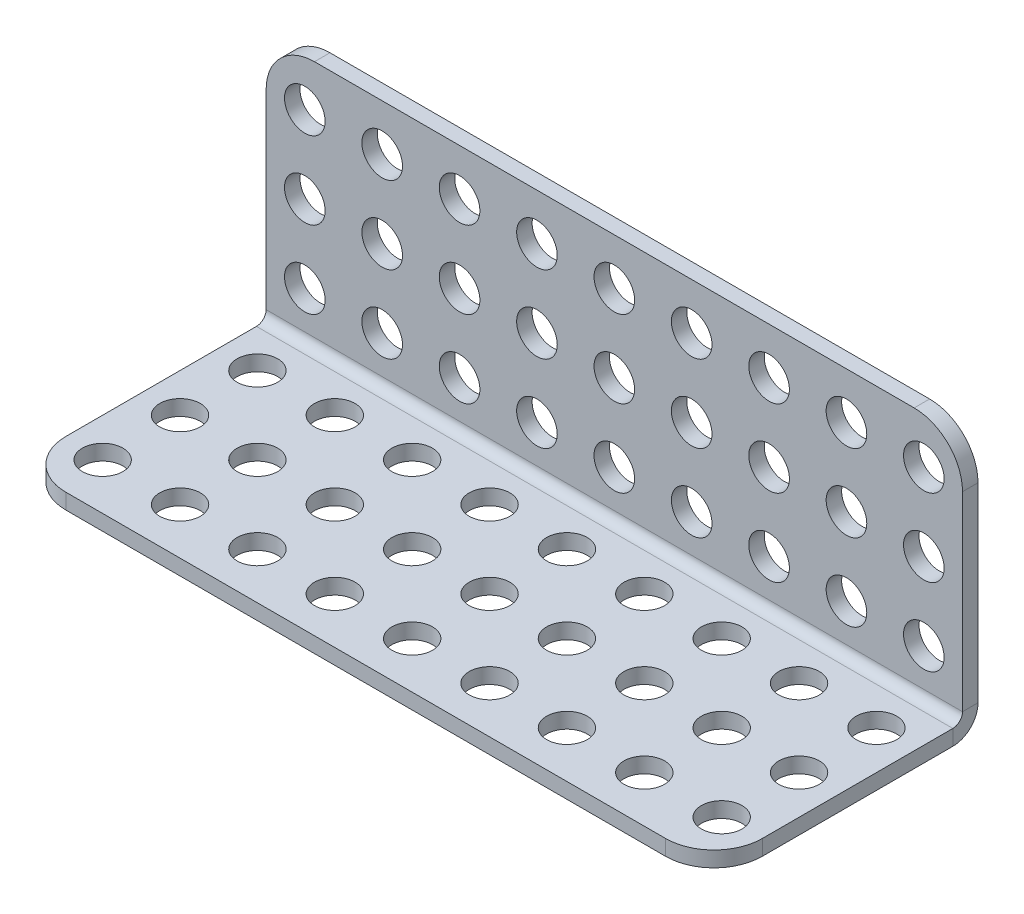
from build123d import *

# Parameters (mm, degrees)
BASE_FLANGE1_DEPTH         = 72
FILLET1_R                  = 5
SKETCH6_R                  = 2.1
CUT_EXTRUDE1_DEPTH         = 82.177459926
SKETCH7_R                  = 2.1
CUT_EXTRUDE2_DEPTH         = 82.177459926
LPATTERN2_COUNT            = 3
LPATTERN2_PITCH            = 8
LPATTERN3_COUNT            = 3
LPATTERN3_PITCH            = 8
LPATTERN1_COUNT            = 9
LPATTERN1_PITCH            = 8
LPATTERN1_COPY_1_SKETCH_R  = 2.1
LPATTERN1_COPY_1_DEPTH     = 82.177459926
LPATTERN1_COPY_2_SKETCH_R  = 2.1
LPATTERN1_COPY_2_DEPTH     = 82.177459926
LPATTERN1_COPY_3_SKETCH_R  = 2.1
LPATTERN1_COPY_3_DEPTH     = 82.177459926
LPATTERN1_COPY_4_SKETCH_R  = 2.1
LPATTERN1_COPY_4_DEPTH     = 82.177459926
LPATTERN1_COPY_5_SKETCH_R  = 2.1
LPATTERN1_COPY_5_DEPTH     = 82.177459926
LPATTERN1_COPY_6_SKETCH_R  = 2.1
LPATTERN1_COPY_6_DEPTH     = 82.177459926
LPATTERN1_COPY_7_SKETCH_R  = 2.1
LPATTERN1_COPY_7_DEPTH     = 82.177459926
LPATTERN1_COPY_8_SKETCH_R  = 2.1
LPATTERN1_COPY_8_DEPTH     = 82.177459926
LPATTERN1_COPY_9_SKETCH_R  = 2.1
LPATTERN1_COPY_9_DEPTH     = 82.177459926
LPATTERN1_COPY_10_SKETCH_R = 2.1
LPATTERN1_COPY_10_DEPTH    = 82.177459926
LPATTERN1_COPY_11_SKETCH_R = 2.1
LPATTERN1_COPY_11_DEPTH    = 82.177459926
LPATTERN1_COPY_12_SKETCH_R = 2.1
LPATTERN1_COPY_12_DEPTH    = 82.177459926
LPATTERN1_COPY_13_SKETCH_R = 2.1
LPATTERN1_COPY_13_DEPTH    = 82.177459926
LPATTERN1_COPY_14_SKETCH_R = 2.1
LPATTERN1_COPY_14_DEPTH    = 82.177459926
LPATTERN1_COPY_15_SKETCH_R = 2.1
LPATTERN1_COPY_15_DEPTH    = 82.177459926
LPATTERN1_COPY_16_SKETCH_R = 2.1
LPATTERN1_COPY_16_DEPTH    = 82.177459926
LPATTERN1_COPY_17_SKETCH_R = 2.1
LPATTERN1_COPY_17_DEPTH    = 82.177459926
LPATTERN1_COPY_18_SKETCH_R = 2.1
LPATTERN1_COPY_18_DEPTH    = 82.177459926
LPATTERN1_COPY_19_SKETCH_R = 2.1
LPATTERN1_COPY_19_DEPTH    = 82.177459926
LPATTERN1_COPY_20_SKETCH_R = 2.1
LPATTERN1_COPY_20_DEPTH    = 82.177459926
LPATTERN1_COPY_21_SKETCH_R = 2.1
LPATTERN1_COPY_21_DEPTH    = 82.177459926
LPATTERN1_COPY_22_SKETCH_R = 2.1
LPATTERN1_COPY_22_DEPTH    = 82.177459926
LPATTERN1_COPY_23_SKETCH_R = 2.1
LPATTERN1_COPY_23_DEPTH    = 82.177459926
LPATTERN1_COPY_24_SKETCH_R = 2.1
LPATTERN1_COPY_24_DEPTH    = 82.177459926
LPATTERN1_COPY_25_SKETCH_R = 2.1
LPATTERN1_COPY_25_DEPTH    = 82.177459926
LPATTERN1_COPY_26_SKETCH_R = 2.1
LPATTERN1_COPY_26_DEPTH    = 82.177459926
LPATTERN1_COPY_27_SKETCH_R = 2.1
LPATTERN1_COPY_27_DEPTH    = 82.177459926
LPATTERN1_COPY_28_SKETCH_R = 2.1
LPATTERN1_COPY_28_DEPTH    = 82.177459926
LPATTERN1_COPY_29_SKETCH_R = 2.1
LPATTERN1_COPY_29_DEPTH    = 82.177459926
LPATTERN1_COPY_30_SKETCH_R = 2.1
LPATTERN1_COPY_30_DEPTH    = 82.177459926
LPATTERN1_COPY_31_SKETCH_R = 2.1
LPATTERN1_COPY_31_DEPTH    = 82.177459926
LPATTERN1_COPY_32_SKETCH_R = 2.1
LPATTERN1_COPY_32_DEPTH    = 82.177459926


# Sheet-metal steps are written as plain solids
with BuildPart() as part:
    # Sketch1 → Base-Flange1 (new body)
    with BuildSketch(Plane(origin=(0, 0, 0), x_dir=(0, 0, -1), z_dir=(1, 0, 0))):
        with BuildLine():
            Line((0, 27.3), (0, 2.6))
            ThreePointArc((0, 2.6), (-0.761522369, 0.761522369), (-2.6, 0))
            Line((-2.6, 0), (-27.3, 0))
            Line((-27.3, 0), (-27.3, 1.6))
            Line((-27.3, 1.6), (-2.6, 1.6))
            ThreePointArc((-2.6, 1.6), (-1.892893219, 1.892893219), (-1.6, 2.6))
            Line((-1.6, 2.6), (-1.6, 27.3))
            Line((-1.6, 27.3), (0, 27.3))
        make_face()
    extrude(amount=BASE_FLANGE1_DEPTH)

    # Fillet1
    fillet1_edges = [part.edges().sort_by_distance(p)[0] for p in [
        (72, 27.3, 0.8),
        (72, 0.8, 27.3),
        (0, 27.3, 0.8),
        (0, 0.8, 27.3),
    ]]
    fillet(fillet1_edges, radius=FILLET1_R)

    # Sketch6 → Cut-Extrude1 (cut, through all)
    with BuildSketch(Plane.XY.offset(1.6)):
        with Locations((4, 6.5)):
            Circle(SKETCH6_R)
    cut_extrude1 = extrude(amount=-CUT_EXTRUDE1_DEPTH, mode=Mode.SUBTRACT)

    # Sketch7 → Cut-Extrude2 (cut, through all)
    with BuildSketch(Plane(origin=(0, 1.6, 0), x_dir=(1, 0, 0), z_dir=(0, 1, 0))):
        with Locations(Location((4, -6.5, 0), (0, 0, 270))):
            Circle(SKETCH7_R)
    cut_extrude2 = extrude(amount=-CUT_EXTRUDE2_DEPTH, mode=Mode.SUBTRACT)

    # LPattern2: Cut-Extrude1 ×3
    with Locations(*[(0, i * LPATTERN2_PITCH, 0) for i in range(1, LPATTERN2_COUNT)]):
        add(cut_extrude1, mode=Mode.SUBTRACT)

    # LPattern3: Cut-Extrude2 ×3
    with Locations(*[(0, 0, i * LPATTERN3_PITCH) for i in range(1, LPATTERN3_COUNT)]):
        add(cut_extrude2, mode=Mode.SUBTRACT)

    # LPattern1: Cut-Extrude1, Cut-Extrude2 ×9
    with Locations(*[(i * LPATTERN1_PITCH, 0, 0) for i in range(1, LPATTERN1_COUNT)]):
        add(cut_extrude1, mode=Mode.SUBTRACT)
        add(cut_extrude2, mode=Mode.SUBTRACT)

    # LPattern1 copy 1 sketch → LPattern1 copy 1 (cut, through all)
    with BuildSketch(Plane(origin=(8, 8, 1.6), x_dir=(1, 0, 0), z_dir=(0, 0, 1))):
        with Locations((4, 6.5)):
            Circle(LPATTERN1_COPY_1_SKETCH_R)
    extrude(amount=-LPATTERN1_COPY_1_DEPTH, mode=Mode.SUBTRACT)

    # LPattern1 copy 2 sketch → LPattern1 copy 2 (cut, through all)
    with BuildSketch(Plane(origin=(16, 8, 1.6), x_dir=(1, 0, 0), z_dir=(0, 0, 1))):
        with Locations((4, 6.5)):
            Circle(LPATTERN1_COPY_2_SKETCH_R)
    extrude(amount=-LPATTERN1_COPY_2_DEPTH, mode=Mode.SUBTRACT)

    # LPattern1 copy 3 sketch → LPattern1 copy 3 (cut, through all)
    with BuildSketch(Plane(origin=(24, 8, 1.6), x_dir=(1, 0, 0), z_dir=(0, 0, 1))):
        with Locations((4, 6.5)):
            Circle(LPATTERN1_COPY_3_SKETCH_R)
    extrude(amount=-LPATTERN1_COPY_3_DEPTH, mode=Mode.SUBTRACT)

    # LPattern1 copy 4 sketch → LPattern1 copy 4 (cut, through all)
    with BuildSketch(Plane(origin=(32, 8, 1.6), x_dir=(1, 0, 0), z_dir=(0, 0, 1))):
        with Locations((4, 6.5)):
            Circle(LPATTERN1_COPY_4_SKETCH_R)
    extrude(amount=-LPATTERN1_COPY_4_DEPTH, mode=Mode.SUBTRACT)

    # LPattern1 copy 5 sketch → LPattern1 copy 5 (cut, through all)
    with BuildSketch(Plane(origin=(40, 8, 1.6), x_dir=(1, 0, 0), z_dir=(0, 0, 1))):
        with Locations((4, 6.5)):
            Circle(LPATTERN1_COPY_5_SKETCH_R)
    extrude(amount=-LPATTERN1_COPY_5_DEPTH, mode=Mode.SUBTRACT)

    # LPattern1 copy 6 sketch → LPattern1 copy 6 (cut, through all)
    with BuildSketch(Plane(origin=(48, 8, 1.6), x_dir=(1, 0, 0), z_dir=(0, 0, 1))):
        with Locations((4, 6.5)):
            Circle(LPATTERN1_COPY_6_SKETCH_R)
    extrude(amount=-LPATTERN1_COPY_6_DEPTH, mode=Mode.SUBTRACT)

    # LPattern1 copy 7 sketch → LPattern1 copy 7 (cut, through all)
    with BuildSketch(Plane(origin=(56, 8, 1.6), x_dir=(1, 0, 0), z_dir=(0, 0, 1))):
        with Locations((4, 6.5)):
            Circle(LPATTERN1_COPY_7_SKETCH_R)
    extrude(amount=-LPATTERN1_COPY_7_DEPTH, mode=Mode.SUBTRACT)

    # LPattern1 copy 8 sketch → LPattern1 copy 8 (cut, through all)
    with BuildSketch(Plane(origin=(64, 8, 1.6), x_dir=(1, 0, 0), z_dir=(0, 0, 1))):
        with Locations((4, 6.5)):
            Circle(LPATTERN1_COPY_8_SKETCH_R)
    extrude(amount=-LPATTERN1_COPY_8_DEPTH, mode=Mode.SUBTRACT)

    # LPattern1 copy 9 sketch → LPattern1 copy 9 (cut, through all)
    with BuildSketch(Plane(origin=(8, 16, 1.6), x_dir=(1, 0, 0), z_dir=(0, 0, 1))):
        with Locations((4, 6.5)):
            Circle(LPATTERN1_COPY_9_SKETCH_R)
    extrude(amount=-LPATTERN1_COPY_9_DEPTH, mode=Mode.SUBTRACT)

    # LPattern1 copy 10 sketch → LPattern1 copy 10 (cut, through all)
    with BuildSketch(Plane(origin=(16, 16, 1.6), x_dir=(1, 0, 0), z_dir=(0, 0, 1))):
        with Locations((4, 6.5)):
            Circle(LPATTERN1_COPY_10_SKETCH_R)
    extrude(amount=-LPATTERN1_COPY_10_DEPTH, mode=Mode.SUBTRACT)

    # LPattern1 copy 11 sketch → LPattern1 copy 11 (cut, through all)
    with BuildSketch(Plane(origin=(24, 16, 1.6), x_dir=(1, 0, 0), z_dir=(0, 0, 1))):
        with Locations((4, 6.5)):
            Circle(LPATTERN1_COPY_11_SKETCH_R)
    extrude(amount=-LPATTERN1_COPY_11_DEPTH, mode=Mode.SUBTRACT)

    # LPattern1 copy 12 sketch → LPattern1 copy 12 (cut, through all)
    with BuildSketch(Plane(origin=(32, 16, 1.6), x_dir=(1, 0, 0), z_dir=(0, 0, 1))):
        with Locations((4, 6.5)):
            Circle(LPATTERN1_COPY_12_SKETCH_R)
    extrude(amount=-LPATTERN1_COPY_12_DEPTH, mode=Mode.SUBTRACT)

    # LPattern1 copy 13 sketch → LPattern1 copy 13 (cut, through all)
    with BuildSketch(Plane(origin=(40, 16, 1.6), x_dir=(1, 0, 0), z_dir=(0, 0, 1))):
        with Locations((4, 6.5)):
            Circle(LPATTERN1_COPY_13_SKETCH_R)
    extrude(amount=-LPATTERN1_COPY_13_DEPTH, mode=Mode.SUBTRACT)

    # LPattern1 copy 14 sketch → LPattern1 copy 14 (cut, through all)
    with BuildSketch(Plane(origin=(48, 16, 1.6), x_dir=(1, 0, 0), z_dir=(0, 0, 1))):
        with Locations((4, 6.5)):
            Circle(LPATTERN1_COPY_14_SKETCH_R)
    extrude(amount=-LPATTERN1_COPY_14_DEPTH, mode=Mode.SUBTRACT)

    # LPattern1 copy 15 sketch → LPattern1 copy 15 (cut, through all)
    with BuildSketch(Plane(origin=(56, 16, 1.6), x_dir=(1, 0, 0), z_dir=(0, 0, 1))):
        with Locations((4, 6.5)):
            Circle(LPATTERN1_COPY_15_SKETCH_R)
    extrude(amount=-LPATTERN1_COPY_15_DEPTH, mode=Mode.SUBTRACT)

    # LPattern1 copy 16 sketch → LPattern1 copy 16 (cut, through all)
    with BuildSketch(Plane(origin=(64, 16, 1.6), x_dir=(1, 0, 0), z_dir=(0, 0, 1))):
        with Locations((4, 6.5)):
            Circle(LPATTERN1_COPY_16_SKETCH_R)
    extrude(amount=-LPATTERN1_COPY_16_DEPTH, mode=Mode.SUBTRACT)

    # LPattern1 copy 17 sketch → LPattern1 copy 17 (cut, through all)
    with BuildSketch(Plane(origin=(8, 1.6, 8), x_dir=(1, 0, 0), z_dir=(0, 1, 0))):
        with Locations(Location((4, -6.5, 0), (0, 0, 270))):
            Circle(LPATTERN1_COPY_17_SKETCH_R)
    extrude(amount=-LPATTERN1_COPY_17_DEPTH, mode=Mode.SUBTRACT)

    # LPattern1 copy 18 sketch → LPattern1 copy 18 (cut, through all)
    with BuildSketch(Plane(origin=(16, 1.6, 8), x_dir=(1, 0, 0), z_dir=(0, 1, 0))):
        with Locations(Location((4, -6.5, 0), (0, 0, 270))):
            Circle(LPATTERN1_COPY_18_SKETCH_R)
    extrude(amount=-LPATTERN1_COPY_18_DEPTH, mode=Mode.SUBTRACT)

    # LPattern1 copy 19 sketch → LPattern1 copy 19 (cut, through all)
    with BuildSketch(Plane(origin=(24, 1.6, 8), x_dir=(1, 0, 0), z_dir=(0, 1, 0))):
        with Locations(Location((4, -6.5, 0), (0, 0, 270))):
            Circle(LPATTERN1_COPY_19_SKETCH_R)
    extrude(amount=-LPATTERN1_COPY_19_DEPTH, mode=Mode.SUBTRACT)

    # LPattern1 copy 20 sketch → LPattern1 copy 20 (cut, through all)
    with BuildSketch(Plane(origin=(32, 1.6, 8), x_dir=(1, 0, 0), z_dir=(0, 1, 0))):
        with Locations(Location((4, -6.5, 0), (0, 0, 270))):
            Circle(LPATTERN1_COPY_20_SKETCH_R)
    extrude(amount=-LPATTERN1_COPY_20_DEPTH, mode=Mode.SUBTRACT)

    # LPattern1 copy 21 sketch → LPattern1 copy 21 (cut, through all)
    with BuildSketch(Plane(origin=(40, 1.6, 8), x_dir=(1, 0, 0), z_dir=(0, 1, 0))):
        with Locations(Location((4, -6.5, 0), (0, 0, 270))):
            Circle(LPATTERN1_COPY_21_SKETCH_R)
    extrude(amount=-LPATTERN1_COPY_21_DEPTH, mode=Mode.SUBTRACT)

    # LPattern1 copy 22 sketch → LPattern1 copy 22 (cut, through all)
    with BuildSketch(Plane(origin=(48, 1.6, 8), x_dir=(1, 0, 0), z_dir=(0, 1, 0))):
        with Locations(Location((4, -6.5, 0), (0, 0, 270))):
            Circle(LPATTERN1_COPY_22_SKETCH_R)
    extrude(amount=-LPATTERN1_COPY_22_DEPTH, mode=Mode.SUBTRACT)

    # LPattern1 copy 23 sketch → LPattern1 copy 23 (cut, through all)
    with BuildSketch(Plane(origin=(56, 1.6, 8), x_dir=(1, 0, 0), z_dir=(0, 1, 0))):
        with Locations(Location((4, -6.5, 0), (0, 0, 270))):
            Circle(LPATTERN1_COPY_23_SKETCH_R)
    extrude(amount=-LPATTERN1_COPY_23_DEPTH, mode=Mode.SUBTRACT)

    # LPattern1 copy 24 sketch → LPattern1 copy 24 (cut, through all)
    with BuildSketch(Plane(origin=(64, 1.6, 8), x_dir=(1, 0, 0), z_dir=(0, 1, 0))):
        with Locations(Location((4, -6.5, 0), (0, 0, 270))):
            Circle(LPATTERN1_COPY_24_SKETCH_R)
    extrude(amount=-LPATTERN1_COPY_24_DEPTH, mode=Mode.SUBTRACT)

    # LPattern1 copy 25 sketch → LPattern1 copy 25 (cut, through all)
    with BuildSketch(Plane(origin=(8, 1.6, 16), x_dir=(1, 0, 0), z_dir=(0, 1, 0))):
        with Locations(Location((4, -6.5, 0), (0, 0, 270))):
            Circle(LPATTERN1_COPY_25_SKETCH_R)
    extrude(amount=-LPATTERN1_COPY_25_DEPTH, mode=Mode.SUBTRACT)

    # LPattern1 copy 26 sketch → LPattern1 copy 26 (cut, through all)
    with BuildSketch(Plane(origin=(16, 1.6, 16), x_dir=(1, 0, 0), z_dir=(0, 1, 0))):
        with Locations(Location((4, -6.5, 0), (0, 0, 270))):
            Circle(LPATTERN1_COPY_26_SKETCH_R)
    extrude(amount=-LPATTERN1_COPY_26_DEPTH, mode=Mode.SUBTRACT)

    # LPattern1 copy 27 sketch → LPattern1 copy 27 (cut, through all)
    with BuildSketch(Plane(origin=(24, 1.6, 16), x_dir=(1, 0, 0), z_dir=(0, 1, 0))):
        with Locations(Location((4, -6.5, 0), (0, 0, 270))):
            Circle(LPATTERN1_COPY_27_SKETCH_R)
    extrude(amount=-LPATTERN1_COPY_27_DEPTH, mode=Mode.SUBTRACT)

    # LPattern1 copy 28 sketch → LPattern1 copy 28 (cut, through all)
    with BuildSketch(Plane(origin=(32, 1.6, 16), x_dir=(1, 0, 0), z_dir=(0, 1, 0))):
        with Locations(Location((4, -6.5, 0), (0, 0, 270))):
            Circle(LPATTERN1_COPY_28_SKETCH_R)
    extrude(amount=-LPATTERN1_COPY_28_DEPTH, mode=Mode.SUBTRACT)

    # LPattern1 copy 29 sketch → LPattern1 copy 29 (cut, through all)
    with BuildSketch(Plane(origin=(40, 1.6, 16), x_dir=(1, 0, 0), z_dir=(0, 1, 0))):
        with Locations(Location((4, -6.5, 0), (0, 0, 270))):
            Circle(LPATTERN1_COPY_29_SKETCH_R)
    extrude(amount=-LPATTERN1_COPY_29_DEPTH, mode=Mode.SUBTRACT)

    # LPattern1 copy 30 sketch → LPattern1 copy 30 (cut, through all)
    with BuildSketch(Plane(origin=(48, 1.6, 16), x_dir=(1, 0, 0), z_dir=(0, 1, 0))):
        with Locations(Location((4, -6.5, 0), (0, 0, 270))):
            Circle(LPATTERN1_COPY_30_SKETCH_R)
    extrude(amount=-LPATTERN1_COPY_30_DEPTH, mode=Mode.SUBTRACT)

    # LPattern1 copy 31 sketch → LPattern1 copy 31 (cut, through all)
    with BuildSketch(Plane(origin=(56, 1.6, 16), x_dir=(1, 0, 0), z_dir=(0, 1, 0))):
        with Locations(Location((4, -6.5, 0), (0, 0, 270))):
            Circle(LPATTERN1_COPY_31_SKETCH_R)
    extrude(amount=-LPATTERN1_COPY_31_DEPTH, mode=Mode.SUBTRACT)

    # LPattern1 copy 32 sketch → LPattern1 copy 32 (cut, through all)
    with BuildSketch(Plane(origin=(64, 1.6, 16), x_dir=(1, 0, 0), z_dir=(0, 1, 0))):
        with Locations(Location((4, -6.5, 0), (0, 0, 270))):
            Circle(LPATTERN1_COPY_32_SKETCH_R)
    extrude(amount=-LPATTERN1_COPY_32_DEPTH, mode=Mode.SUBTRACT)


solid = part.part
